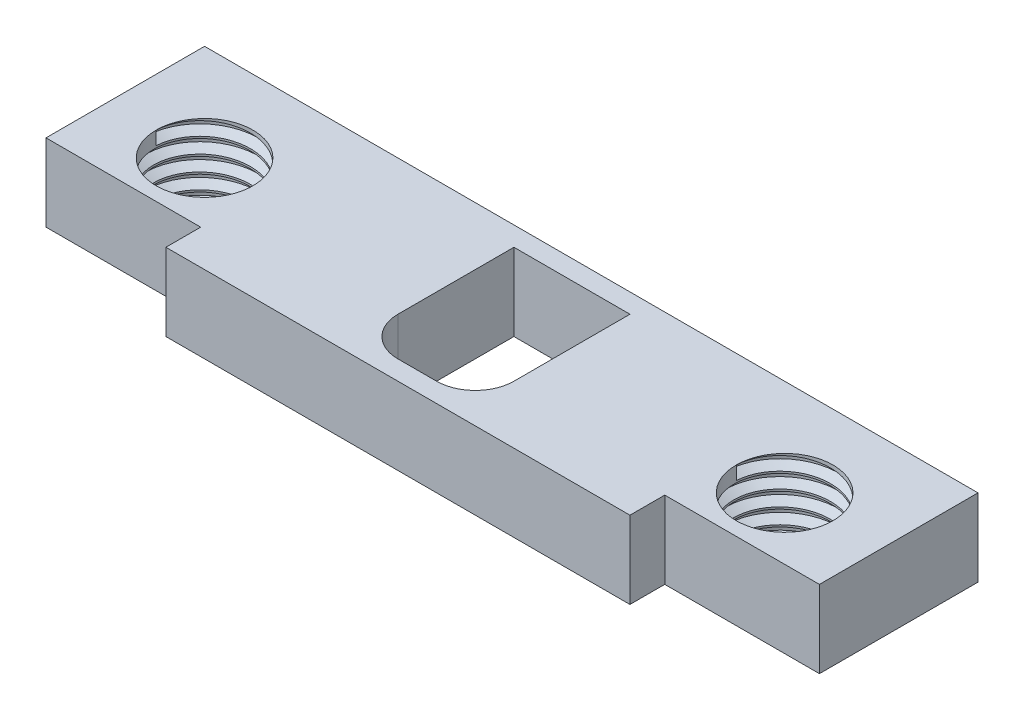
from build123d import *

# Parameters (mm, degrees)
SKETCH1_W           = 200
SKETCH1_H           = 50
SKETCH1_R           = 12.5
BOSS_EXTRUDE1_DEPTH = 20
THREAD1_PITCH       = 4
THREAD2_PITCH       = 4
SKETCH2_W           = 40
SKETCH2_H           = 9
CUT_EXTRUDE1_DEPTH  = 106.000000138


with BuildPart() as part:
    # Sketch1 → Boss-Extrude1 (new body)
    with BuildSketch(Plane(origin=(0, 0, 0), x_dir=(1, 0, 0), z_dir=(0, 1, 0))):
        Rectangle(SKETCH1_W, SKETCH1_H)
        with Locations(Location((-75, 0, 0), (0, 0, 270))):
            Circle(SKETCH1_R, mode=Mode.SUBTRACT)
        with Locations(Location((75, 0, 0), (0, 0, 90))):
            Circle(SKETCH1_R, mode=Mode.SUBTRACT)
        with BuildLine():
            Line((-15, 20), (15, 20))
            Line((15, 20), (15, -10))
            ThreePointArc((15, -10), (12.071067812, -17.071067812), (5, -20))
            Line((5, -20), (-5, -20))
            ThreePointArc((-5, -20), (-12.071067812, -17.071067812), (-15, -10))
            Line((-15, -10), (-15, 20))
        make_face(mode=Mode.SUBTRACT)
    extrude(amount=BOSS_EXTRUDE1_DEPTH)

    # Thread1: the profile of Thread Profile1 profile screwed along a right-hand helix of 5 turns, 12 arcs to a turn; built about Z, then put on its axis
    thread1_z = Axis((0, 0, 0), (0, 0, 1))
    thread1_corners = [(12.4997, 0, -0.000173205), (12.4997, 0, 3.500173194), (14.6650635, 0, 2.249999995), (14.6650635, 0, 1.249999995)]
    with BuildLine(mode=Mode.PRIVATE) as thread1_profile:
        Line(thread1_corners[0], thread1_corners[1])
        Line(thread1_corners[1], thread1_corners[2])
        Line(thread1_corners[2], thread1_corners[3])
        Line(thread1_corners[3], thread1_corners[0])
    thread1_cap = Face(thread1_profile.wire())
    thread1_turn_angles = [0, 15, 30, 45, 60, 75, 90, 105, 120, 135, 150, 165, 180, 195, 210, 225, 240, 255, 270, 285, 300, 315, 330, 345, 360]
    thread1_turn_weights = [1, 0.9659258262890683, 1, 0.9659258262890683, 1, 0.9659258262890683, 1, 0.9659258262890683, 1, 0.9659258262890683, 1, 0.9659258262890683, 1, 0.9659258262890683, 1, 0.9659258262890683, 1, 0.9659258262890683, 1, 0.9659258262890683, 1, 0.9659258262890683, 1, 0.9659258262890683, 1]
    thread1_turn_rails = [Edge.make_bspline([Vector(p[0], p[1], 0).rotate(thread1_z, thread1_turn_angles[k]) / thread1_turn_weights[k] + Vector(0, 0, p[2] + THREAD1_PITCH * thread1_turn_angles[k] / 360) for k in range(25)], [0, 0, 0, 1, 1, 2, 2, 3, 3, 4, 4, 5, 5, 6, 6, 7, 7, 8, 8, 9, 9, 10, 10, 11, 11, 12, 12, 12], 2, thread1_turn_weights) for p in thread1_corners]
    thread1_turn_sides = [Face.make_surface_from_curves(thread1_turn_rails[p[0]], thread1_turn_rails[p[1]]) for p in [(0, 1), (1, 2), (2, 3), (3, 0)]]
    thread1 = Plane(origin=(-75, 20, 0), x_dir=(-1, 0, 0), z_dir=(0, -1, 0)) * Solid(Shell([*[p.moved(Location((0, 0, THREAD1_PITCH * i))) for i in range(5) for p in thread1_turn_sides], thread1_cap, thread1_cap.rotate(thread1_z, 1800).moved(Location((0, 0, THREAD1_PITCH * 1800 / 360)))]))
    add(thread1, mode=Mode.SUBTRACT)

    # Thread2: the profile of Thread Profile2 profile screwed along a right-hand helix of 5 turns, 12 arcs to a turn; built about Z, then put on its axis
    thread2_z = Axis((0, 0, 0), (0, 0, 1))
    thread2_corners = [(12.4997, 0, -0.000173205), (12.4997, 0, 3.500173194), (14.6650635, 0, 2.249999995), (14.6650635, 0, 1.249999995)]
    with BuildLine(mode=Mode.PRIVATE) as thread2_profile:
        Line(thread2_corners[0], thread2_corners[1])
        Line(thread2_corners[1], thread2_corners[2])
        Line(thread2_corners[2], thread2_corners[3])
        Line(thread2_corners[3], thread2_corners[0])
    thread2_cap = Face(thread2_profile.wire())
    thread2_turn_angles = [0, 15, 30, 45, 60, 75, 90, 105, 120, 135, 150, 165, 180, 195, 210, 225, 240, 255, 270, 285, 300, 315, 330, 345, 360]
    thread2_turn_weights = [1, 0.9659258262890683, 1, 0.9659258262890683, 1, 0.9659258262890683, 1, 0.9659258262890683, 1, 0.9659258262890683, 1, 0.9659258262890683, 1, 0.9659258262890683, 1, 0.9659258262890683, 1, 0.9659258262890683, 1, 0.9659258262890683, 1, 0.9659258262890683, 1, 0.9659258262890683, 1]
    thread2_turn_rails = [Edge.make_bspline([Vector(p[0], p[1], 0).rotate(thread2_z, thread2_turn_angles[k]) / thread2_turn_weights[k] + Vector(0, 0, p[2] + THREAD2_PITCH * thread2_turn_angles[k] / 360) for k in range(25)], [0, 0, 0, 1, 1, 2, 2, 3, 3, 4, 4, 5, 5, 6, 6, 7, 7, 8, 8, 9, 9, 10, 10, 11, 11, 12, 12, 12], 2, thread2_turn_weights) for p in thread2_corners]
    thread2_turn_sides = [Face.make_surface_from_curves(thread2_turn_rails[p[0]], thread2_turn_rails[p[1]]) for p in [(0, 1), (1, 2), (2, 3), (3, 0)]]
    thread2 = Plane(origin=(75, 20, 0), x_dir=(-1, 0, 0), z_dir=(0, -1, 0)) * Solid(Shell([*[p.moved(Location((0, 0, THREAD2_PITCH * i))) for i in range(5) for p in thread2_turn_sides], thread2_cap, thread2_cap.rotate(thread2_z, 1800).moved(Location((0, 0, THREAD2_PITCH * 1800 / 360)))]))
    add(thread2, mode=Mode.SUBTRACT)

    # Sketch2 → Cut-Extrude1 (cut, through all)
    with BuildSketch(Plane(origin=(0, 20, 0), x_dir=(1, 0, 0), z_dir=(0, 1, 0))):
        with Locations((-80, -20.5)):
            Rectangle(SKETCH2_W, SKETCH2_H)
        with Locations((80, -20.5)):
            Rectangle(SKETCH2_W, SKETCH2_H)
    extrude(amount=-CUT_EXTRUDE1_DEPTH, mode=Mode.SUBTRACT)


solid = part.part
